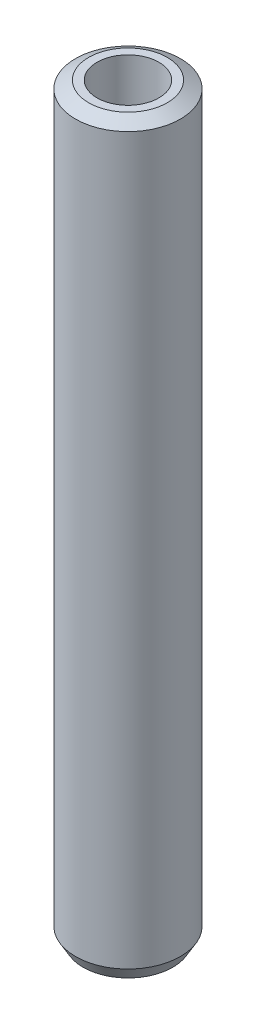
from build123d import *
from OCP.BRepFilletAPI import BRepFilletAPI_MakeChamfer

# Parameters (mm, degrees)
SKETCH1_R           = 15
BOSS_EXTRUDE1_DEPTH = 213.33993489
SKETCH2_R           = 8.847485813
CUT_EXTRUDE1_DEPTH  = 215.391995697
CHAMFER1_SIZE       = 2.166481856
CHAMFER1_SIZE2      = 3.752456649


with BuildPart() as part:
    # Sketch1 → Boss-Extrude1 (new body)
    with BuildSketch(Plane(origin=(0, 0, 0), x_dir=(1, 0, 0), z_dir=(0, 1, 0))):
        Circle(SKETCH1_R)
    extrude(amount=BOSS_EXTRUDE1_DEPTH)

    # Sketch2 → Cut-Extrude1 (cut, through all)
    with BuildSketch(Plane(origin=(0, 0, 0), x_dir=(1, 0, 0), z_dir=(0, 1, 0))):
        Circle(SKETCH2_R)
    extrude(amount=CUT_EXTRUDE1_DEPTH, mode=Mode.SUBTRACT)

    # Chamfer1: one chamfer whose edges measure the first distance from different faces: ONE call of the kernel's chamfer builder (chamfer() names one face for all edges)
    chamfer1_edges_1 = [part.edges().sort_by_distance(p)[0] for p in [
        (-15, 213.33993489, 0),
    ]]
    chamfer1_side_1 = [part.faces().sort_by_distance(p)[0] for p in [
        (-15, 106.669967445, 0),
    ]]
    chamfer1_edges_2 = [part.edges().sort_by_distance(p)[0] for p in [
        (-15, 0, 0),
    ]]
    chamfer1_side_2 = [part.faces().sort_by_distance(p)[0] for p in [
        (-14.575735931, 0, 0),
    ]]
    chamfer1 = BRepFilletAPI_MakeChamfer(part.part.solid().wrapped)
    for e in chamfer1_edges_1:
        chamfer1.Add(CHAMFER1_SIZE, CHAMFER1_SIZE2, e.wrapped, chamfer1_side_1[0].wrapped)  # the first distance lies on this face
    for e in chamfer1_edges_2:
        chamfer1.Add(CHAMFER1_SIZE, CHAMFER1_SIZE2, e.wrapped, chamfer1_side_2[0].wrapped)  # the first distance lies on this face
    add(Compound.cast(chamfer1.Shape()), mode=Mode.REPLACE)


solid = part.part
